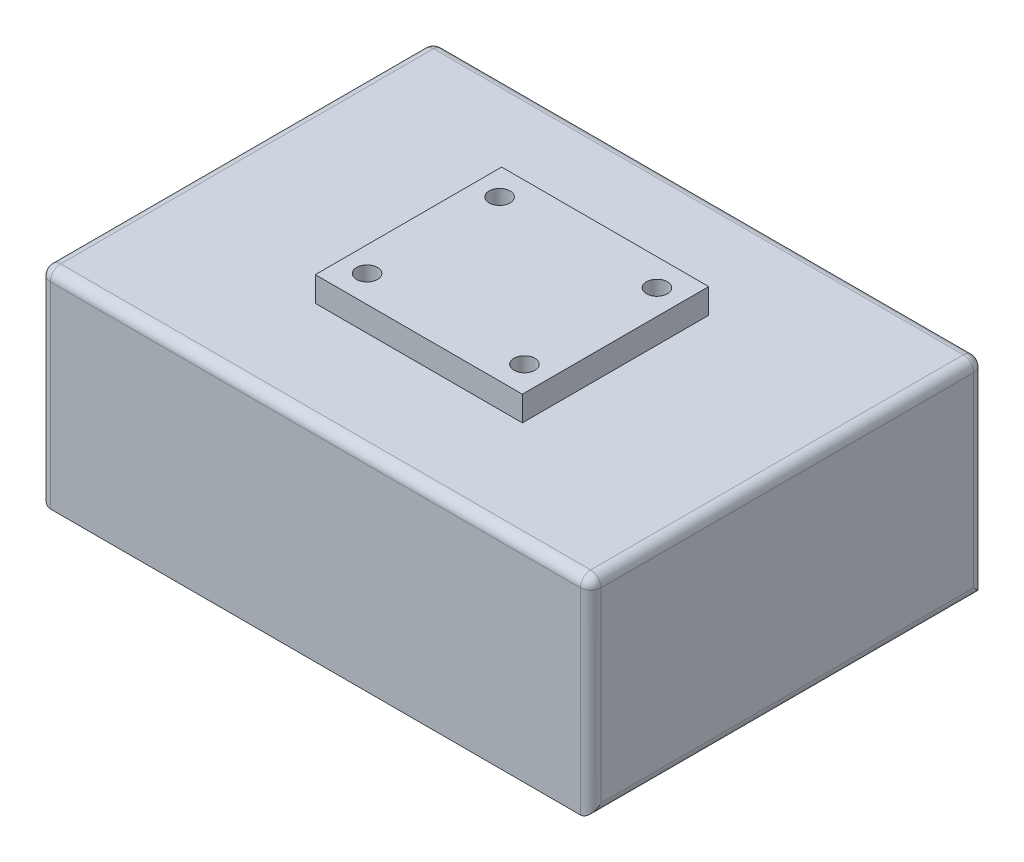
from build123d import *

# Parameters (mm, degrees)
SKETCH1_W           = 133
SKETCH1_H           = 95
BOSS_EXTRUDE1_DEPTH = 50
CUT_EXTRUDE1_START  = -2
CUT_EXTRUDE1_DEPTH  = 129
SKETCH3_R           = 42.5
CUT_EXTRUDE2_DEPTH  = 10
FILLET1_R           = 2.5
SKETCH4_W           = 50
SKETCH4_H           = 45
BOSS_EXTRUDE2_DEPTH = 6
SKETCH5_R           = 2.525
CUT_EXTRUDE3_DEPTH  = 4


with BuildPart() as part:
    # Sketch1 → Boss-Extrude1 (new body)
    with BuildSketch(Plane(origin=(0, 0, 0), x_dir=(1, 0, 0), z_dir=(0, 1, 0))):
        with Locations((66.5, 47.5)):
            Rectangle(SKETCH1_W, SKETCH1_H)
    extrude(amount=BOSS_EXTRUDE1_DEPTH)

    # Sketch2 → Cut-Extrude1 (cut)
    with BuildSketch(Plane.ZY.offset(CUT_EXTRUDE1_START)):
        with BuildLine():
            Line((-94, 0), (-1, 0))
            ThreePointArc((-1, 0), (-47.5, 46.5), (-94, 0))
        make_face()
    extrude(amount=-CUT_EXTRUDE1_DEPTH, mode=Mode.SUBTRACT)

    # Sketch3 → Cut-Extrude2 (cut)
    with BuildSketch(Plane.ZY):
        with Locations((-47.5, 0)):
            Circle(SKETCH3_R)
    extrude(amount=-CUT_EXTRUDE2_DEPTH, mode=Mode.SUBTRACT)

    # Fillet1
    # the kernel refuses this fillet: 2.5 mm, written as the material it takes off along each edge
    with BuildSketch(Plane(origin=(130.5, 47.5, -92.5), x_dir=(0, 1, 0), z_dir=(1, 0, 0))) as fillet1_piece_1_section:
        Polygon((0, 0), (FILLET1_R * 1.02, 0), (FILLET1_R * 1.02, -FILLET1_R * 1.02), (0, -FILLET1_R * 1.02), align=None)
    fillet1_piece_1 = extrude(amount=FILLET1_R * 1.02, mode=Mode.PRIVATE)
    fillet1_piece_1 = fillet1_piece_1 - Plane(origin=(130.5, 47.5, -92.5), x_dir=(0, -0.7071067811865475, 0.7071067811865475), z_dir=(1, 0, 0)) * Sphere(FILLET1_R, mode=Mode.PRIVATE)
    add(fillet1_piece_1, mode=Mode.SUBTRACT)
    with BuildSketch(Plane(origin=(2.5, 47.5, -92.5), x_dir=(0, 1, 0), z_dir=(-1, 0, 0))) as fillet1_piece_2_section:
        Polygon((0, 0), (FILLET1_R * 1.02, 0), (FILLET1_R * 1.02, FILLET1_R * 1.02), (0, FILLET1_R * 1.02), align=None)
    fillet1_piece_2 = extrude(amount=FILLET1_R * 1.02, mode=Mode.PRIVATE)
    fillet1_piece_2 = fillet1_piece_2 - Plane(origin=(2.5, 47.5, -92.5), x_dir=(0, -0.7071067811865475, 0.7071067811865475), z_dir=(-1, 0, 0)) * Sphere(FILLET1_R, mode=Mode.PRIVATE)
    add(fillet1_piece_2, mode=Mode.SUBTRACT)
    with BuildSketch(Plane(origin=(130.5, 47.5, -2.5), x_dir=(1, 0, 0), z_dir=(0, 0, 1))) as fillet1_piece_3_section:
        Polygon((0, 0), (FILLET1_R * 1.02, 0), (FILLET1_R * 1.02, FILLET1_R * 1.02), (0, FILLET1_R * 1.02), align=None)
    fillet1_piece_3 = extrude(amount=FILLET1_R * 1.02, mode=Mode.PRIVATE)
    fillet1_piece_3 = fillet1_piece_3 - Plane(origin=(130.5, 47.5, -2.5), x_dir=(-0.7071067811865475, -0.7071067811865475, 0), z_dir=(0, 0, 1)) * Sphere(FILLET1_R, mode=Mode.PRIVATE)
    add(fillet1_piece_3, mode=Mode.SUBTRACT)
    with BuildSketch(Plane(origin=(2.5, 47.5, -2.5), x_dir=(-1, 0, 0), z_dir=(0, 0, 1))) as fillet1_piece_4_section:
        Polygon((0, 0), (FILLET1_R * 1.02, 0), (FILLET1_R * 1.02, -FILLET1_R * 1.02), (0, -FILLET1_R * 1.02), align=None)
    fillet1_piece_4 = extrude(amount=FILLET1_R * 1.02, mode=Mode.PRIVATE)
    fillet1_piece_4 = fillet1_piece_4 - Plane(origin=(2.5, 47.5, -2.5), x_dir=(0.7071067811865475, -0.7071067811865475, 0), z_dir=(0, 0, 1)) * Sphere(FILLET1_R, mode=Mode.PRIVATE)
    add(fillet1_piece_4, mode=Mode.SUBTRACT)
    with BuildSketch(Plane(origin=(130.5, 50, -95), x_dir=(0, 0, 1), z_dir=(-1, 0, 0))) as fillet1_piece_5:
        with BuildLine():
            CenterArc((FILLET1_R, -FILLET1_R), FILLET1_R, 90, 90)
            Line((0, -FILLET1_R), (0, 0))
            Line((0, 0), (FILLET1_R, 0))
        make_face()
    extrude(amount=128, mode=Mode.SUBTRACT)
    with BuildSketch(Plane(origin=(133, 50, -2.5), x_dir=(0, -1, 0), z_dir=(0, 0, -1)), Plane(origin=(0, 50, -92.5), x_dir=(0, -1, 0), z_dir=(0, 0, 1))) as fillet1_piece_6:
        with BuildLine():
            CenterArc((FILLET1_R, FILLET1_R), FILLET1_R, 180, 90)
            Line((0, FILLET1_R), (0, 0))
            Line((0, 0), (FILLET1_R, 0))
        make_face()
    extrude(amount=90, mode=Mode.SUBTRACT)
    with BuildSketch(Plane(origin=(2.5, 50, 0), x_dir=(0, -1, 0), z_dir=(1, 0, 0))) as fillet1_piece_7:
        with BuildLine():
            CenterArc((FILLET1_R, FILLET1_R), FILLET1_R, 180, 90)
            Line((0, FILLET1_R), (0, 0))
            Line((0, 0), (FILLET1_R, 0))
        make_face()
    extrude(amount=128, mode=Mode.SUBTRACT)
    with BuildSketch(Plane(origin=(133, -6.25, 0), x_dir=(-1, 0, 0), z_dir=(0, 1, 0)), Plane(origin=(133, -6.25, -95), x_dir=(0, 0, 1), z_dir=(0, 1, 0))) as fillet1_piece_8:
        with BuildLine():
            CenterArc((FILLET1_R, -FILLET1_R), FILLET1_R, 90, 90)
            Line((0, -FILLET1_R), (0, 0))
            Line((0, 0), (FILLET1_R, 0))
        make_face()
    extrude(amount=53.75, mode=Mode.SUBTRACT)
    with BuildSketch(Plane(origin=(133, 0, 6.25), x_dir=(0, 1, 0), z_dir=(0, 0, -1))) as fillet1_piece_9:
        with BuildLine():
            CenterArc((FILLET1_R, -FILLET1_R), FILLET1_R, 90, 90)
            Line((0, -FILLET1_R), (0, 0))
            Line((0, 0), (FILLET1_R, 0))
        make_face()
    extrude(amount=107.5, mode=Mode.SUBTRACT)
    with BuildSketch(Plane(origin=(0, -6.25, -95), x_dir=(0, 0, 1), z_dir=(0, 1, 0)), Plane(origin=(0, -6.25, 0), x_dir=(1, 0, 0), z_dir=(0, 1, 0))) as fillet1_piece_10:
        with BuildLine():
            CenterArc((FILLET1_R, FILLET1_R), FILLET1_R, 180, 90)
            Line((0, FILLET1_R), (0, 0))
            Line((0, 0), (FILLET1_R, 0))
        make_face()
    extrude(amount=53.75, mode=Mode.SUBTRACT)
    with BuildSketch(Plane(origin=(0, 0, -11.25), x_dir=(0, 1, 0), z_dir=(0, 0, 1)), Plane(origin=(0, 0, -101.25), x_dir=(0, 1, 0), z_dir=(0, 0, 1))) as fillet1_piece_11:
        with BuildLine():
            CenterArc((FILLET1_R, -FILLET1_R), FILLET1_R, 90, 90)
            Line((0, -FILLET1_R), (0, 0))
            Line((0, 0), (FILLET1_R, 0))
        make_face()
    extrude(amount=17.5, mode=Mode.SUBTRACT)
    with BuildSketch(Plane(origin=(0, 0, -47.5), x_dir=(0, -0.14381889116089108, 0.9896040251258338), z_dir=(0, -0.9896040251258338, -0.14381889116089108))) as fillet1_piece_12:
        with BuildLine():
            CenterArc((44.949489743, -2.5), FILLET1_R, 90, 78.463040967)
            Line((42.5, -2), (42.5, 0))
            Line((42.5, 0), (44.949489743, 0))
        make_face()
    revolve(axis=Axis((0, 0, -47.5), (-1, 0, 0)), revolution_arc=196.537779553, mode=Mode.SUBTRACT)

    # Sketch4 → Boss-Extrude2 (add)
    with BuildSketch(Plane(origin=(0, 50, 0), x_dir=(1, 0, 0), z_dir=(0, 1, 0))):
        with Locations((66.5, 47.5)):
            Rectangle(SKETCH4_W, SKETCH4_H)
    extrude(amount=BOSS_EXTRUDE2_DEPTH)

    # Sketch5 → Cut-Extrude3 (cut)
    with BuildSketch(Plane(origin=(0, 56, 0), x_dir=(1, 0, 0), z_dir=(0, 1, 0))):
        with Locations(Location((47.5, 63.5, 0), (0, 0, 270))):
            Circle(SKETCH5_R)
        with Locations(Location((85.5, 63.5, 0), (0, 0, 270))):
            Circle(SKETCH5_R)
        with Locations(Location((85.5, 31.5, 0), (0, 0, 270))):
            Circle(SKETCH5_R)
        with Locations(Location((47.5, 31.5, 0), (0, 0, 270))):
            Circle(SKETCH5_R)
    extrude(amount=-CUT_EXTRUDE3_DEPTH, mode=Mode.SUBTRACT)


solid = part.part
